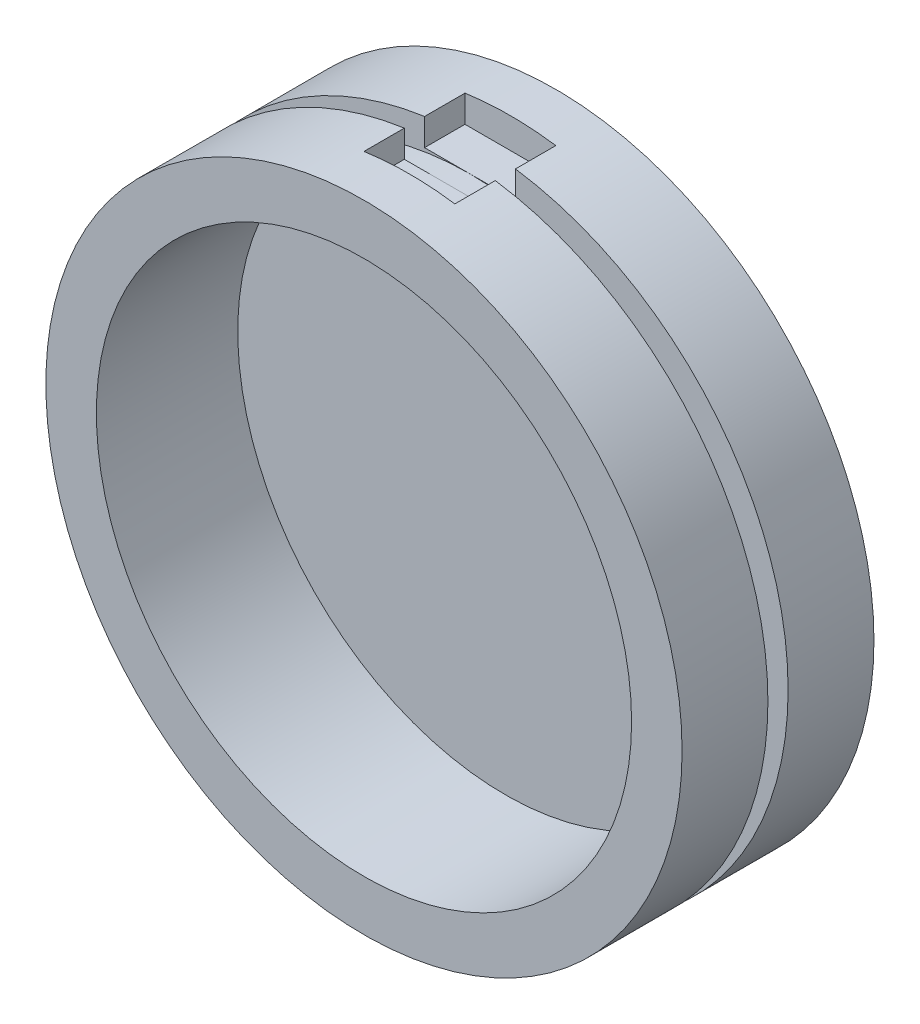
from build123d import *

# Parameters (mm, degrees)
SKETCH7_W          = 9
SKETCH7_H          = 10
CUT_EXTRUDE1_DEPTH = 3


with BuildPart() as part:
    # Sketch2 → Revolve1 (revolve)
    with BuildSketch(Plane(origin=(0, 0, 0), x_dir=(0, 0, -1), z_dir=(1, 0, 0))):
        Polygon((0, 0), (0, 31.5), (-8.5, 31.5), (-8.5, 28.5), (-10.5, 28.5), (-10.5, 31.5), (-19, 31.5), (-19, 26.5), (-5, 26.5), (-5, 0), align=None)
    revolve(axis=Axis((0, 0, 5), (0, 0, -1)))

    # Sketch7 → Cut-Extrude1 (cut)
    with BuildSketch(Plane(origin=(0, 31.5, 0), x_dir=(1, 0, 0), z_dir=(0, 1, 0))):
        with Locations((0, -9.5)):
            Rectangle(SKETCH7_W, SKETCH7_H)
    cut_extrude1 = extrude(amount=-CUT_EXTRUDE1_DEPTH, mode=Mode.SUBTRACT)

    # Mirror1: Cut-Extrude1 across plane
    add(cut_extrude1.mirror(Plane.ZX), mode=Mode.SUBTRACT)


solid = part.part
